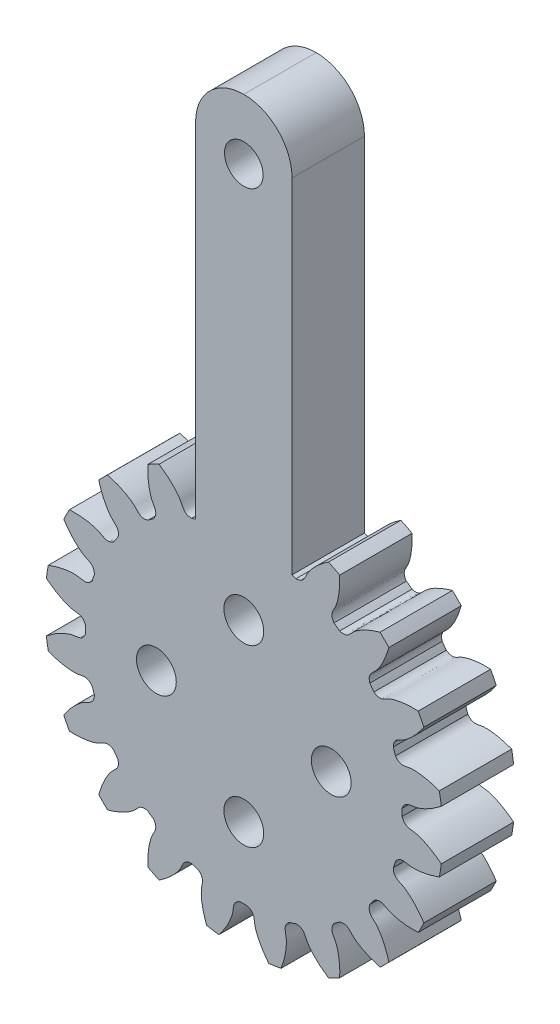
from build123d import *

# Parameters (mm, degrees)
SKETCH_1_R               = 16.5
EXTRUDE_1_DEPTH          = 6
CUT_EXTRUDE_1_DEPTH      = 25.093567606
PATTERN_CIRCULAR_1_COUNT = 20
SKETCH_5_R               = 10.75
CUT_EXTRUDE_2_DEPTH      = 0.01
SKETCH_7_R               = 0.75
CUT_EXTRUDE_4_DEPTH      = 3
SKETCH_8_W               = 8
SKETCH_8_H               = 38.434899951
EXTRUDE_2_DEPTH          = 6
SKETCH_9_R               = 1.6
SKETCH_9_W               = 8
SKETCH_9_H               = 5
CUT_EXTRUDE_5_DEPTH      = 10
FILLET_1_R               = 4
SKETCH_10_R              = 1.65
CUT_EXTRUDE_6_DEPTH      = 49.259500692


with BuildPart() as part:
    # 草图1 → 凸台-拉伸1 (new body)
    with BuildSketch(Plane.XY):
        Circle(SKETCH_1_R)
    extrude(amount=EXTRUDE_1_DEPTH)

    # 草图2 → 切除-拉伸1 (cut, through all)
    with BuildSketch(Plane.XY):
        with BuildLine():
            ThreePointArc((0.289974901, 13.121796354), (0, 13.125), (-0.289974901, 13.121796354))
            add(Edge.make_bspline(
                [(-0.289974901, 13.121796354), (-0.916784107, 13.340213268), (-0.835626149, 13.780670548), (-0.919345585, 14.205014104), (-0.928338279, 14.246334921), (-0.939466335, 14.292951923), (-0.952938145, 14.344795254), (-0.96896871, 14.401787245), (-0.987768083, 14.463844242), (-1.009544807, 14.5308761), (-1.034504625, 14.602786421), (-1.06285065, 14.679472568), (-1.094783098, 14.760825751), (-1.130499153, 14.846731096), (-1.170192797, 14.937067727), (-1.214054647, 15.031708847), (-1.2622718, 15.130521826), (-1.315027675, 15.233368292), (-1.372501858, 15.340104225), (-1.434869948, 15.450580056), (-1.502303414, 15.564640771), (-1.574969439, 15.682126017), (-1.653030782, 15.802870208), (-1.736645634, 15.926702646), (-1.825967477, 16.05344763), (-1.921144951, 16.182924586), (-2.022321721, 16.314948181), (-2.129636342, 16.449328459), (-2.24322214, 16.585870967), (-2.363207078, 16.724376892), (-2.489713645, 16.864643194), (-2.622858733, 17.006462752), (-2.762753527, 17.149624504), (-2.909503389, 17.29391359), (-3.06320776, 17.439111509), (-3.223960048, 17.584996263), (-3.391847534, 17.731342516), (-3.566951278, 17.877921749), (-3.749346018, 18.024502419), (-3.939100102, 18.170850122), (-4.136275349, 18.31672776), (-4.412210386, 18.512459802), (-4.625898619, 18.654498902), (-4.771736973, 18.747377789)],
                knots=[0, 0, 0, 0, 0.165916003, 0.170905922, 0.176663519, 0.183188797, 0.190481754, 0.198542391, 0.207370708, 0.216966704, 0.22733038, 0.238461736, 0.250360771, 0.263027487, 0.276461881, 0.290663956, 0.30563371, 0.321371144, 0.337876258, 0.355149051, 0.373189524, 0.391997677, 0.411573509, 0.431917021, 0.453028213, 0.474907084, 0.497553636, 0.520967867, 0.545149777, 0.570099367, 0.595816637, 0.622301587, 0.649554216, 0.677574526, 0.706362514, 0.735918183, 0.766241531, 0.797332559, 0.829191267, 0.861817654, 0.895211721, 0.929373468, 1, 1, 1, 1], degree=3))
            ThreePointArc((-4.771736973, 18.747377789), (0, 19.345119481), (4.771736973, 18.747377789))
            add(Edge.make_bspline(
                [(0.289974901, 13.121796354), (0.916784107, 13.340213268), (0.835626149, 13.780670548), (0.919345585, 14.205014104), (0.928338279, 14.246334921), (0.939466335, 14.292951923), (0.952938145, 14.344795254), (0.96896871, 14.401787245), (0.987768083, 14.463844242), (1.009544807, 14.5308761), (1.034504625, 14.602786421), (1.06285065, 14.679472568), (1.094783098, 14.760825751), (1.130499153, 14.846731096), (1.170192797, 14.937067727), (1.214054647, 15.031708847), (1.2622718, 15.130521826), (1.315027675, 15.233368292), (1.372501858, 15.340104225), (1.434869948, 15.450580056), (1.502303414, 15.564640771), (1.574969439, 15.682126017), (1.653030782, 15.802870208), (1.736645634, 15.926702646), (1.825967477, 16.05344763), (1.921144951, 16.182924586), (2.022321721, 16.314948181), (2.129636342, 16.449328459), (2.24322214, 16.585870967), (2.363207078, 16.724376892), (2.489713645, 16.864643194), (2.622858733, 17.006462752), (2.762753527, 17.149624504), (2.909503389, 17.29391359), (3.06320776, 17.439111509), (3.223960048, 17.584996263), (3.391847534, 17.731342516), (3.566951278, 17.877921749), (3.749346018, 18.024502419), (3.939100102, 18.170850122), (4.136275349, 18.31672776), (4.412210386, 18.512459802), (4.625898619, 18.654498902), (4.771736973, 18.747377789)],
                knots=[0, 0, 0, 0, 0.165916003, 0.170905922, 0.176663519, 0.183188797, 0.190481754, 0.198542391, 0.207370708, 0.216966704, 0.22733038, 0.238461736, 0.250360771, 0.263027487, 0.276461881, 0.290663956, 0.30563371, 0.321371144, 0.337876258, 0.355149051, 0.373189524, 0.391997677, 0.411573509, 0.431917021, 0.453028213, 0.474907084, 0.497553636, 0.520967867, 0.545149777, 0.570099367, 0.595816637, 0.622301587, 0.649554216, 0.677574526, 0.706362514, 0.735918183, 0.766241531, 0.797332559, 0.829191267, 0.861817654, 0.895211721, 0.929373468, 1, 1, 1, 1], degree=3))
        make_face()
    cut_extrude_1 = extrude(amount=CUT_EXTRUDE_1_DEPTH, mode=Mode.SUBTRACT)

    # 阵列(圆周)1: 切除-拉伸1 ×20 about axis
    pattern_circular_1_axis = Axis((0, 0, -0.3), (0, 0, 1))
    for i in range(1, PATTERN_CIRCULAR_1_COUNT):
        add(cut_extrude_1.rotate(pattern_circular_1_axis, i * 360 / PATTERN_CIRCULAR_1_COUNT), mode=Mode.SUBTRACT)

    # 草图5 → 切除-拉伸2 (cut)
    with BuildSketch(Plane(origin=(0, 0, 0), x_dir=(-1, 0, 0), z_dir=(0, 0, -1))):
        Circle(SKETCH_5_R)
    extrude(amount=-CUT_EXTRUDE_2_DEPTH, mode=Mode.SUBTRACT)

    # 草图7 → 切除-拉伸4 (cut)
    with BuildSketch(Plane(origin=(0, 0, 0.01), x_dir=(-1, 0, 0), z_dir=(0, 0, -1))):
        with Locations((0, 7.25)):
            Circle(SKETCH_7_R)
        with Locations((7.25, 0)):
            Circle(SKETCH_7_R)
        with Locations(Location((0, -7.25, 0), (0, 0, 180))):
            Circle(SKETCH_7_R)
        with Locations(Location((-7.25, 0, 0), (0, 0, 180))):
            Circle(SKETCH_7_R)
    extrude(amount=-CUT_EXTRUDE_4_DEPTH, mode=Mode.SUBTRACT)

    # 草图8 → 凸台-拉伸2 (add)
    with BuildSketch(Plane(origin=(0, 0, 0), x_dir=(-1, 0, 0), z_dir=(0, 0, -1))):
        with Locations((0, 30.782550025)):
            Rectangle(SKETCH_8_W, SKETCH_8_H)
    extrude(amount=-EXTRUDE_2_DEPTH)

    # 草图9 → 切除-拉伸5 (cut)
    with BuildSketch(Plane(origin=(0, 0, 0), x_dir=(-1, 0, 0), z_dir=(0, 0, -1))):
        with Locations((0, 40)):
            Circle(SKETCH_9_R)
        with Locations((0, 47.5)):
            Rectangle(SKETCH_9_W, SKETCH_9_H)
    extrude(amount=-CUT_EXTRUDE_5_DEPTH, mode=Mode.SUBTRACT)

    # 圆角1
    fillet_1_edges = [part.edges().sort_by_distance(p)[0] for p in [
        (4, 45, 3),
        (-4, 45, 3),
    ]]
    fillet(fillet_1_edges, radius=FILLET_1_R - 0.0001)  # a hair under: the kernel refuses the full size

    # 草图10 → 切除-拉伸6 (cut, through all)
    with BuildSketch(Plane.XY.offset(6)):
        with Locations((0, 7.25)):
            Circle(SKETCH_10_R)
        with Locations((7.25, 0)):
            Circle(SKETCH_10_R)
        with Locations((0, -7.25)):
            Circle(SKETCH_10_R)
        with Locations((-7.25, 0)):
            Circle(SKETCH_10_R)
    extrude(amount=-CUT_EXTRUDE_6_DEPTH, mode=Mode.SUBTRACT)


solid = part.part
